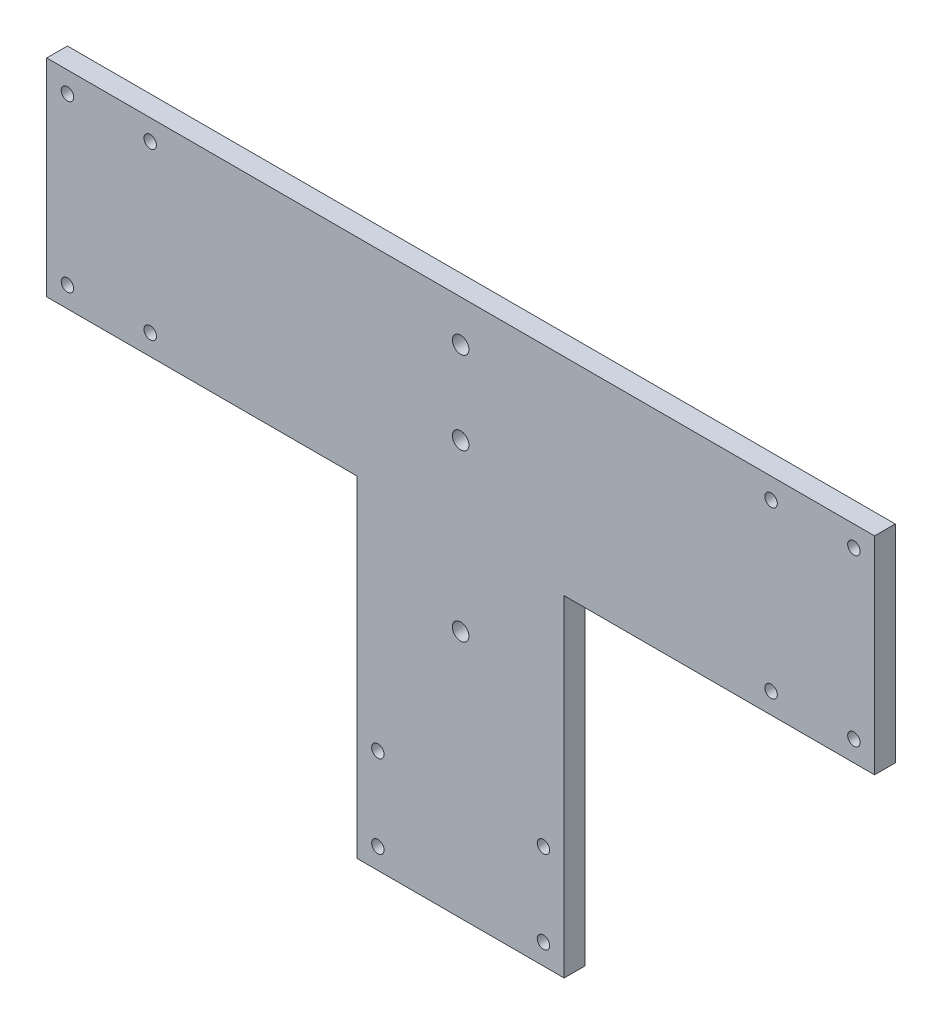
from build123d import *

# Parameters (mm, degrees)
ESQUISSE1_R        = 2
ESQUISSE1_R_2      = 1.5
BOSS_EXTRU_1_DEPTH = 5


with BuildPart() as part:
    # Esquisse1 → Boss.-Extru.1 (new body)
    with BuildSketch(Plane.XY):
        Polygon((0, 50), (-100, 50), (-100, 0), (-25, 0), (-25, -80), (25, -80), (25, 0), (100, 0), (100, 50), align=None)
        with Locations((0, 20)):
            Circle(ESQUISSE1_R, mode=Mode.SUBTRACT)
        with Locations((0, -20)):
            Circle(ESQUISSE1_R, mode=Mode.SUBTRACT)
        with Locations((0, 40)):
            Circle(ESQUISSE1_R, mode=Mode.SUBTRACT)
        with Locations((-20, -55)):
            Circle(ESQUISSE1_R_2, mode=Mode.SUBTRACT)
        with Locations((20, -55)):
            Circle(ESQUISSE1_R_2, mode=Mode.SUBTRACT)
        with Locations((20, -75)):
            Circle(ESQUISSE1_R_2, mode=Mode.SUBTRACT)
        with Locations((-20, -75)):
            Circle(ESQUISSE1_R_2, mode=Mode.SUBTRACT)
        with Locations((-95, 45)):
            Circle(ESQUISSE1_R_2, mode=Mode.SUBTRACT)
        with Locations((-75, 45)):
            Circle(ESQUISSE1_R_2, mode=Mode.SUBTRACT)
        with Locations((-75, 5)):
            Circle(ESQUISSE1_R_2, mode=Mode.SUBTRACT)
        with Locations((-95, 5)):
            Circle(ESQUISSE1_R_2, mode=Mode.SUBTRACT)
        with Locations((75, 5)):
            Circle(ESQUISSE1_R_2, mode=Mode.SUBTRACT)
        with Locations((95, 5)):
            Circle(ESQUISSE1_R_2, mode=Mode.SUBTRACT)
        with Locations((75, 45)):
            Circle(ESQUISSE1_R_2, mode=Mode.SUBTRACT)
        with Locations((95, 45)):
            Circle(ESQUISSE1_R_2, mode=Mode.SUBTRACT)
    extrude(amount=BOSS_EXTRU_1_DEPTH)


solid = part.part
